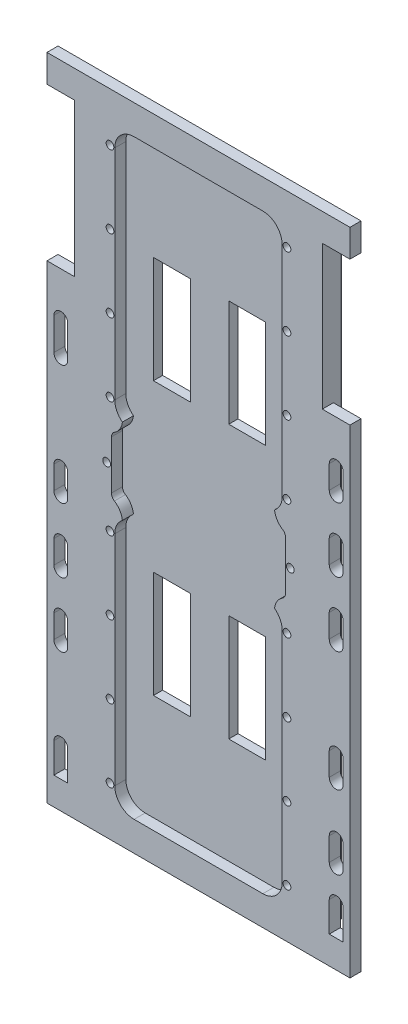
from build123d import *

# Parameters (mm, degrees)
SKETCH1_W               = 134.5
SKETCH1_H               = 323
BOSS_EXTRUDE1_DEPTH     = 5
SKETCH1_3_W             = 134.5
SKETCH1_3_H             = 323
BOSS_EXTRUDE2_DEPTH     = 6
BOSS_EXTRUDE8_START     = 0.1
BOSS_EXTRUDE8_DEPTH     = 6
SKETCH3_W               = 164.5
SKETCH3_H               = 15
BOSS_EXTRUDE9_DEPTH     = 6
SKETCH4_R               = 1.8
CUT_EXTRUDE1_DEPTH      = 196.034131628
CHAMFER1_SIZE           = 0.3
CHAMFER1_SIZE2          = 10
FILLET1_R               = 1
CUT_EXTRUDE2_DEPTH      = 195.816099181
CUT_EXTRUDE2_DEPTH_BACK = 195.816099181
SKETCH6_W               = 20
SKETCH6_H               = 58


# Read off the part's stored shape, not the designer's step: Boss-Extrude8
with BuildPart() as part:
    # Sketch1 → Boss-Extrude1 (new body)
    with BuildSketch(Plane(origin=(0, 0, 0.1), x_dir=(1, 0, 0), z_dir=(0, 0, -1))):
        Rectangle(SKETCH1_W, SKETCH1_H)
    extrude(amount=BOSS_EXTRUDE1_DEPTH)

    # Sketch1<3> → Boss-Extrude2 (add)
    with BuildSketch(Plane(origin=(0, 0, 0.1), x_dir=(1, 0, 0), z_dir=(0, 0, -1))):
        Rectangle(SKETCH1_3_W, SKETCH1_3_H)
        with BuildLine():
            Line((45.45, 31.485659466), (45.45, 150))
            ThreePointArc((45.45, 150), (42.66589269, 157.121446482), (35.79, 160.466346067))
            ThreePointArc((35.79, 160.466346067), (35.370336944, 160.491583143), (34.95, 160.5))
            Line((34.95, 160.5), (-34.95, 160.5))
            ThreePointArc((-34.95, 160.5), (-35.370336944, 160.491583143), (-35.79, 160.466346067))
            ThreePointArc((-35.79, 160.466346067), (-42.66589269, 157.121446482), (-45.45, 150))
            Line((-45.45, 150), (-45.45, 31.485659466))
            ThreePointArc((-45.45, 31.485659466), (-44.357328362, 26.821736965), (-41.306728934, 23.128507005))
            ThreePointArc((-41.306728934, 23.128507005), (-42.679763233, 19.15303821), (-45.634615385, 16.159975549))
            ThreePointArc((-45.634615385, 16.159975549), (-46.819703068, 14.892045855), (-47.25, 13.21070024))
            Line((-47.25, 13.21070024), (-47.25, -13.21070024))
            ThreePointArc((-47.25, -13.21070024), (-46.819703068, -14.892045855), (-45.634615385, -16.159975549))
            ThreePointArc((-45.634615385, -16.159975549), (-42.679763233, -19.15303821), (-41.306728934, -23.128507005))
            ThreePointArc((-41.306728934, -23.128507005), (-44.357328362, -26.821736965), (-45.45, -31.485659466))
            Line((-45.45, -31.485659466), (-45.45, -150))
            ThreePointArc((-45.45, -150), (-42.66589269, -157.121446482), (-35.79, -160.466346067))
            ThreePointArc((-35.79, -160.466346067), (-35.370336944, -160.491583143), (-34.95, -160.5))
            Line((-34.95, -160.5), (34.95, -160.5))
            ThreePointArc((34.95, -160.5), (35.370336944, -160.491583143), (35.79, -160.466346067))
            ThreePointArc((35.79, -160.466346067), (42.66589269, -157.121446482), (45.45, -150))
            Line((45.45, -150), (45.45, -31.485659466))
            ThreePointArc((45.45, -31.485659466), (44.357328362, -26.821736965), (41.306728934, -23.128507005))
            ThreePointArc((41.306728934, -23.128507005), (42.679763233, -19.15303821), (45.634615385, -16.159975549))
            ThreePointArc((45.634615385, -16.159975549), (46.819703068, -14.892045855), (47.25, -13.21070024))
            Line((47.25, -13.21070024), (47.25, 13.21070024))
            ThreePointArc((47.25, 13.21070024), (46.819703068, 14.892045855), (45.634615385, 16.159975549))
            ThreePointArc((45.634615385, 16.159975549), (42.679763233, 19.15303821), (41.306728934, 23.128507005))
            ThreePointArc((41.306728934, 23.128507005), (44.357328362, 26.821736965), (45.45, 31.485659466))
        make_face(mode=Mode.SUBTRACT)
    extrude(amount=-BOSS_EXTRUDE2_DEPTH)

    # Boss-Extrude8 outline → Boss-Extrude8 (add)
    # profile 1 of 2: a face of its own
    with BuildSketch(Plane.XY.offset(BOSS_EXTRUDE8_START)):
        with BuildLine():
            Line((-71, -161.5), (-67.25, -161.5))
            Line((-67.25, -161.5), (-67.25, 78.5))
            Line((-67.25, 78.5), (-82.25, 78.5))
            Line((-82.25, 78.5), (-82.25, -161.5))
            Line((-82.25, -161.5), (-78.5, -161.5))
            Line((-78.5, -161.5), (-78.5, -145.25))
            ThreePointArc((-78.5, -145.25), (-74.75, -141.5), (-71, -145.25))
            Line((-71, -145.25), (-71, -161.5))
        make_face()
        with BuildLine():
            ThreePointArc((-78.5, -85.25), (-74.75, -81.5), (-71, -85.25))
            Line((-71, -85.25), (-71, -97.75))
            ThreePointArc((-71, -97.75), (-74.75, -101.5), (-78.5, -97.75))
            Line((-78.5, -97.75), (-78.5, -85.25))
        make_face(mode=Mode.SUBTRACT)
        with BuildLine():
            ThreePointArc((-78.5, -50.25), (-74.75, -46.5), (-71, -50.25))
            Line((-71, -50.25), (-71, -62.75))
            ThreePointArc((-71, -62.75), (-74.75, -66.5), (-78.5, -62.75))
            Line((-78.5, -62.75), (-78.5, -50.25))
        make_face(mode=Mode.SUBTRACT)
        with BuildLine():
            ThreePointArc((-78.5, -15.25), (-74.75, -11.5), (-71, -15.25))
            Line((-71, -15.25), (-71, -27.75))
            ThreePointArc((-71, -27.75), (-74.75, -31.5), (-78.5, -27.75))
            Line((-78.5, -27.75), (-78.5, -15.25))
        make_face(mode=Mode.SUBTRACT)
        with BuildLine():
            ThreePointArc((-78.5, 54.75), (-74.75, 58.5), (-71, 54.75))
            Line((-71, 54.75), (-71, 37.25))
            ThreePointArc((-71, 37.25), (-74.75, 33.5), (-78.5, 37.25))
            Line((-78.5, 37.25), (-78.5, 54.75))
        make_face(mode=Mode.SUBTRACT)
    # profile 2 of 2: a face of its own
    with BuildSketch(Plane.XY.offset(BOSS_EXTRUDE8_START)):
        with BuildLine():
            Line((78.5, -161.5), (82.25, -161.5))
            Line((82.25, -161.5), (82.25, 83.5))
            Line((82.25, 83.5), (67.25, 83.5))
            Line((67.25, 83.5), (67.25, -161.5))
            Line((67.25, -161.5), (71, -161.5))
            Line((71, -161.5), (71, -145.25))
            ThreePointArc((71, -145.25), (74.75, -141.5), (78.5, -145.25))
            Line((78.5, -145.25), (78.5, -161.5))
        make_face()
        with BuildLine():
            ThreePointArc((71, -115.25), (74.75, -111.5), (78.5, -115.25))
            Line((78.5, -115.25), (78.5, -127.75))
            ThreePointArc((78.5, -127.75), (74.75, -131.5), (71, -127.75))
            Line((71, -127.75), (71, -115.25))
        make_face(mode=Mode.SUBTRACT)
        with BuildLine():
            ThreePointArc((71, -75.25), (74.75, -71.5), (78.5, -75.25))
            Line((78.5, -75.25), (78.5, -87.75))
            ThreePointArc((78.5, -87.75), (74.75, -91.5), (71, -87.75))
            Line((71, -87.75), (71, -75.25))
        make_face(mode=Mode.SUBTRACT)
        with BuildLine():
            ThreePointArc((71, -10.25), (74.75, -6.5), (78.5, -10.25))
            Line((78.5, -10.25), (78.5, -22.75))
            ThreePointArc((78.5, -22.75), (74.75, -26.5), (71, -22.75))
            Line((71, -22.75), (71, -10.25))
        make_face(mode=Mode.SUBTRACT)
        with BuildLine():
            ThreePointArc((71, 24.75), (74.75, 28.5), (78.5, 24.75))
            Line((78.5, 24.75), (78.5, 12.25))
            ThreePointArc((78.5, 12.25), (74.75, 8.5), (71, 12.25))
            Line((71, 12.25), (71, 24.75))
        make_face(mode=Mode.SUBTRACT)
        with BuildLine():
            ThreePointArc((71, 59.75), (74.75, 63.5), (78.5, 59.75))
            Line((78.5, 59.75), (78.5, 47.25))
            ThreePointArc((78.5, 47.25), (74.75, 43.5), (71, 47.25))
            Line((71, 47.25), (71, 59.75))
        make_face(mode=Mode.SUBTRACT)
    extrude(amount=BOSS_EXTRUDE8_DEPTH)

    # Sketch3 → Boss-Extrude9 (add)
    with BuildSketch(Plane.XY.offset(0.1)):
        with Locations((0, 169)):
            Rectangle(SKETCH3_W, SKETCH3_H)
        with Locations((0, -169)):
            Rectangle(SKETCH3_W, SKETCH3_H)
    extrude(amount=BOSS_EXTRUDE9_DEPTH)

    # Sketch4 → Cut-Extrude1 (cut, through all)
    with BuildSketch(Plane.XY.offset(6.1)):
        with Locations((-48.05, -150)):
            Circle(SKETCH4_R)
        with Locations((-49.85, 0)):
            Circle(SKETCH4_R)
        with Locations((-48.05, -31.485659466)):
            Circle(SKETCH4_R)
        with Locations((-48.05, 31.485659466)):
            Circle(SKETCH4_R)
        with Locations((-48.05, 150)):
            Circle(SKETCH4_R)
        with Locations((-48.05, 70.990439644)):
            Circle(SKETCH4_R)
        with Locations((-48.05, -70.990439644)):
            Circle(SKETCH4_R)
        with Locations((-48.05, 110.495219822)):
            Circle(SKETCH4_R)
        with Locations((-48.05, -110.495219822)):
            Circle(SKETCH4_R)
        with Locations(Location((48.05, -110.495219822, 0), (0, 0, 180))):
            Circle(SKETCH4_R)
        with Locations(Location((48.05, 110.495219822, 0), (0, 0, 180))):
            Circle(SKETCH4_R)
        with Locations(Location((48.05, -70.990439644, 0), (0, 0, 180))):
            Circle(SKETCH4_R)
        with Locations(Location((48.05, 70.990439644, 0), (0, 0, 180))):
            Circle(SKETCH4_R)
        with Locations(Location((48.05, 150, 0), (0, 0, 180))):
            Circle(SKETCH4_R)
        with Locations(Location((48.05, 31.485659466, 0), (0, 0, 180))):
            Circle(SKETCH4_R)
        with Locations(Location((48.05, -31.485659466, 0), (0, 0, 180))):
            Circle(SKETCH4_R)
        with Locations(Location((49.85, 0, 0), (0, 0, 180))):
            Circle(SKETCH4_R)
        with Locations(Location((48.05, -150, 0), (0, 0, 180))):
            Circle(SKETCH4_R)
    extrude(amount=-CUT_EXTRUDE1_DEPTH, mode=Mode.SUBTRACT)

    # Chamfer1
    chamfer1_edges = [part.edges().sort_by_distance(p)[0] for p in [
        (49.85, -150, 6.1),
        (-49.85, 70.990439644, 6.1),
        (-49.85, -70.990439644, 6.1),
        (49.85, -110.495219822, 6.1),
        (-49.85, 110.495219822, 6.1),
        (-49.85, 150, 6.1),
        (-49.85, 31.485659466, 6.1),
        (-49.85, -31.485659466, 6.1),
        (-51.65, 0, 6.1),
        (51.65, 0, 6.1),
        (49.85, -31.485659466, 6.1),
        (49.85, 31.485659466, 6.1),
        (49.85, 150, 6.1),
        (-49.85, -110.495219822, 6.1),
        (49.85, 110.495219822, 6.1),
        (49.85, -70.990439644, 6.1),
        (49.85, 70.990439644, 6.1),
        (-49.85, -150, 6.1),
    ]]
    chamfer1_side = [part.faces().sort_by_distance(p)[0] for p in [
        (74.75, 79.605526351, 6.1),
    ]]
    chamfer(chamfer1_edges, length=CHAMFER1_SIZE, length2=CHAMFER1_SIZE2, reference=chamfer1_side[0])

    # Fillet1
    fillet1_edges = [part.edges().sort_by_distance(p)[0] for p in [
        (0, -161.5, -4.9),
        (-67.25, 0, -4.9),
        (0, 161.5, -4.9),
        (67.25, 0, -4.9),
    ]]
    fillet(fillet1_edges, radius=FILLET1_R)

    # Sketch6 → Cut-Extrude2 (cut, two sides: drawn at the far end of the back side and taken through both)
    with BuildSketch(Plane.XY.offset(0.1).offset(-CUT_EXTRUDE2_DEPTH_BACK)):
        with Locations((20.45, 74)):
            Rectangle(SKETCH6_W, SKETCH6_H)
        with Locations((-20.45, 74)):
            Rectangle(SKETCH6_W, SKETCH6_H)
        with Locations((-20.45, -74)):
            Rectangle(SKETCH6_W, SKETCH6_H)
        with Locations((20.45, -74)):
            Rectangle(SKETCH6_W, SKETCH6_H)
    extrude(amount=CUT_EXTRUDE2_DEPTH + CUT_EXTRUDE2_DEPTH_BACK, mode=Mode.SUBTRACT)


solid = part.part
